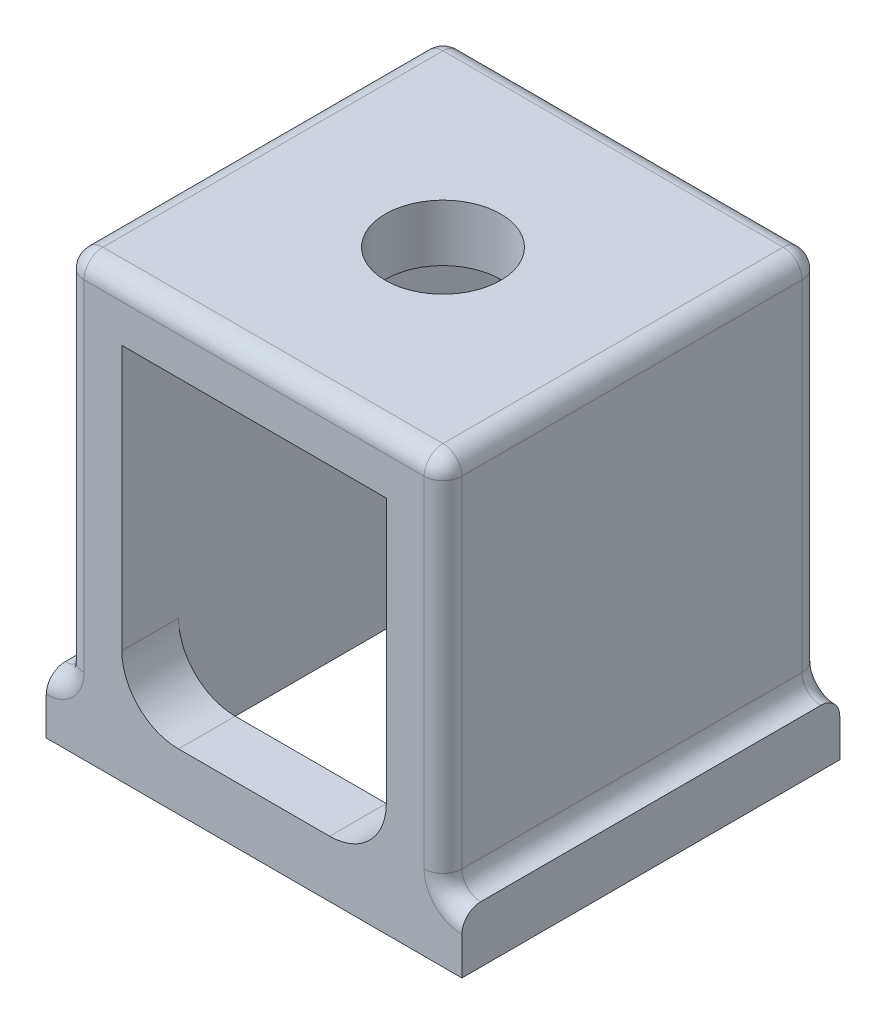
from build123d import *

# Parameters (mm, degrees)
SKETCH_1_W      = 14
SKETCH_1_H      = 20
SKETCH_1_R      = 3.05
EXTRUDE_1_DEPTH = 3
EXTRUDE_2_DEPTH = 20
SKETCH_4_W      = 22
SKETCH_4_H      = 20
SKETCH_4_W_2    = 14
SKETCH_4_H_2    = 14
EXTRUDE_4_DEPTH = 3
FILLET_2_R      = 1
FILLET_3_R      = 3


with BuildPart() as part:
    # 草图1 → 凸台-拉伸1 (new body)
    with BuildSketch(Plane(origin=(0, 0, 0), x_dir=(1, 0, 0), z_dir=(0, 1, 0))):
        Rectangle(SKETCH_1_W, SKETCH_1_H)
        with Locations(Location((0, 0, 0), (0, 0, 270))):
            Circle(SKETCH_1_R, mode=Mode.SUBTRACT)
    extrude(amount=EXTRUDE_1_DEPTH)

    # 草图2 → 凸台-拉伸2 (add)
    with BuildSketch(Plane.XY.offset(10)):
        Polygon((-7, 3), (-7, 0), (-7, -20), (-11, -20), (-11, -17), (-10, -17), (-10, 0), (-10, 3), align=None)
        Polygon((10, 3), (10, 0), (10, -17), (11, -17), (11, -20), (7, -20), (7, 0), (7, 3), align=None)
    extrude(amount=-EXTRUDE_2_DEPTH)

    # 草图4 → 凸台-拉伸4 (add)
    with BuildSketch(Plane.XZ.offset(20)):
        Rectangle(SKETCH_4_W, SKETCH_4_H)
        Rectangle(SKETCH_4_W_2, SKETCH_4_H_2, mode=Mode.SUBTRACT)
    extrude(amount=-EXTRUDE_4_DEPTH)

    # 圆角2
    fillet_2_edges = [part.edges().sort_by_distance(p)[0] for p in [
        (-10, -17, 0),
        (10, -17, 0),
    ]]
    fillet(fillet_2_edges, radius=FILLET_2_R - 0.0001)  # a hair under: the kernel refuses the full size
    fillet_2_2_edges = [part.edges().sort_by_distance(p)[0] for p in [
        (-10, 3, 0),
        (0, 3, -10),
        (10, 3, 0),
        (0, 3, 10),
        (-10, -6.50005, -10),
        (-10, -6.50005, 10),
        (10, -6.50005, -10),
        (10, -6.50005, 10),
        (10.292863929, -16.707136071, 10),
        (10.292863929, -16.707136071, -10),
        (-10.292863929, -16.707136071, 10),
        (-10.292863929, -16.707136071, -10),
    ]]
    fillet(fillet_2_2_edges, radius=FILLET_2_R)

    # 圆角3
    fillet_3_edges = [part.edges().sort_by_distance(p)[0] for p in [
        (7, -17, -8.5),
        (7, -17, 8.5),
        (-7, -17, -8.5),
        (-7, -17, 8.5),
    ]]
    fillet(fillet_3_edges, radius=FILLET_3_R)


solid = part.part
